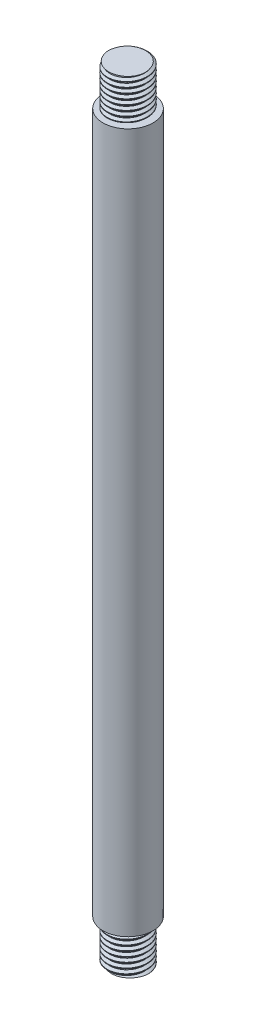
from build123d import *

# Parameters (mm, degrees)
THREAD1_PITCH = 1
THREAD1_TO    = 10
THREAD2_PITCH = 1
THREAD2_TO    = 10


with BuildPart() as part:
    # Sketch1 → Revolve1 (revolve)
    with BuildSketch(Plane.XY, mode=Mode.PRIVATE) as revolve1_sk:
        Polygon((0, 156), (4, 156), (4, 148), (5, 148), (5, 8), (4, 8), (4, 0), (0, 0), align=None)
    revolve(revolve1_sk.sketch.rotate(Axis((0, 0, 0), (0, 1, 0)), 90), axis=Axis((0, 0, 0), (0, 1, 0)))

    # Thread1: arcs per turn and ends read off the stored shape
    # Thread1: the profile of Thread Profile1 profile screwed along a right-hand helix through 10 turns, 8 arcs to a turn; built about Z, then put on its axis
    thread1_z = Axis((0, 0, 0), (0, 0, 1))
    thread1_corners = [(4.0003, 0, -0.000173205), (4.0003, 0, 0.875173202), (3.458734125, 0, 0.562499999), (3.458734125, 0, 0.312499999)]
    with BuildLine(mode=Mode.PRIVATE) as thread1_profile:
        Line(thread1_corners[0], thread1_corners[1])
        Line(thread1_corners[1], thread1_corners[2])
        Line(thread1_corners[2], thread1_corners[3])
        Line(thread1_corners[3], thread1_corners[0])
    thread1_cap = Face(thread1_profile.wire())
    thread1_turn_angles = [0, 22.5, 45, 67.5, 90, 112.5, 135, 157.5, 180, 202.5, 225, 247.5, 270, 292.5, 315, 337.5, 360]
    thread1_turn_weights = [1, 0.9238795325112867, 1, 0.9238795325112867, 1, 0.9238795325112867, 1, 0.9238795325112867, 1, 0.9238795325112867, 1, 0.9238795325112867, 1, 0.9238795325112867, 1, 0.9238795325112867, 1]
    thread1_turn_rails = [Edge.make_bspline([Vector(p[0], p[1], 0).rotate(thread1_z, thread1_turn_angles[k]) / thread1_turn_weights[k] + Vector(0, 0, p[2] + THREAD1_PITCH * thread1_turn_angles[k] / 360) for k in range(17)], [0, 0, 0, 1, 1, 2, 2, 3, 3, 4, 4, 5, 5, 6, 6, 7, 7, 8, 8, 8], 2, thread1_turn_weights) for p in thread1_corners]
    thread1_turn_sides = [Face.make_surface_from_curves(thread1_turn_rails[p[0]], thread1_turn_rails[p[1]]) for p in [(0, 1), (1, 2), (2, 3), (3, 0)]]
    thread1 = Plane(origin=(0, 158, 0), x_dir=(-1, 0, 0), z_dir=(0, -1, 0)) * split(Solid(Shell([*[p.moved(Location((0, 0, THREAD1_PITCH * i))) for i in range(10) for p in thread1_turn_sides], thread1_cap, thread1_cap.rotate(thread1_z, 3600).moved(Location((0, 0, THREAD1_PITCH * 3600 / 360)))])), bisect_by=Plane.XY.offset(THREAD1_TO), keep=Keep.BOTTOM, mode=Mode.PRIVATE)
    add(thread1, mode=Mode.SUBTRACT)

    # Thread2: arcs per turn and ends read off the stored shape
    # Thread2: the profile of Thread Profile2 profile screwed along a right-hand helix through 10 turns, 8 arcs to a turn; built about Z, then put on its axis
    thread2_z = Axis((0, 0, 0), (0, 0, 1))
    thread2_corners = [(4.0003, 0, -0.000173205), (4.0003, 0, 0.875173202), (3.458734125, 0, 0.562499999), (3.458734125, 0, 0.312499999)]
    with BuildLine(mode=Mode.PRIVATE) as thread2_profile:
        Line(thread2_corners[0], thread2_corners[1])
        Line(thread2_corners[1], thread2_corners[2])
        Line(thread2_corners[2], thread2_corners[3])
        Line(thread2_corners[3], thread2_corners[0])
    thread2_cap = Face(thread2_profile.wire())
    thread2_turn_angles = [0, 22.5, 45, 67.5, 90, 112.5, 135, 157.5, 180, 202.5, 225, 247.5, 270, 292.5, 315, 337.5, 360]
    thread2_turn_weights = [1, 0.9238795325112867, 1, 0.9238795325112867, 1, 0.9238795325112867, 1, 0.9238795325112867, 1, 0.9238795325112867, 1, 0.9238795325112867, 1, 0.9238795325112867, 1, 0.9238795325112867, 1]
    thread2_turn_rails = [Edge.make_bspline([Vector(p[0], p[1], 0).rotate(thread2_z, thread2_turn_angles[k]) / thread2_turn_weights[k] + Vector(0, 0, p[2] + THREAD2_PITCH * thread2_turn_angles[k] / 360) for k in range(17)], [0, 0, 0, 1, 1, 2, 2, 3, 3, 4, 4, 5, 5, 6, 6, 7, 7, 8, 8, 8], 2, thread2_turn_weights) for p in thread2_corners]
    thread2_turn_sides = [Face.make_surface_from_curves(thread2_turn_rails[p[0]], thread2_turn_rails[p[1]]) for p in [(0, 1), (1, 2), (2, 3), (3, 0)]]
    thread2 = Plane(origin=(0, -2, 0), x_dir=(1, 0, 0), z_dir=(0, 1, 0)) * split(Solid(Shell([*[p.moved(Location((0, 0, THREAD2_PITCH * i))) for i in range(10) for p in thread2_turn_sides], thread2_cap, thread2_cap.rotate(thread2_z, 3600).moved(Location((0, 0, THREAD2_PITCH * 3600 / 360)))])), bisect_by=Plane.XY.offset(THREAD2_TO), keep=Keep.BOTTOM, mode=Mode.PRIVATE)
    add(thread2, mode=Mode.SUBTRACT)


solid = part.part
